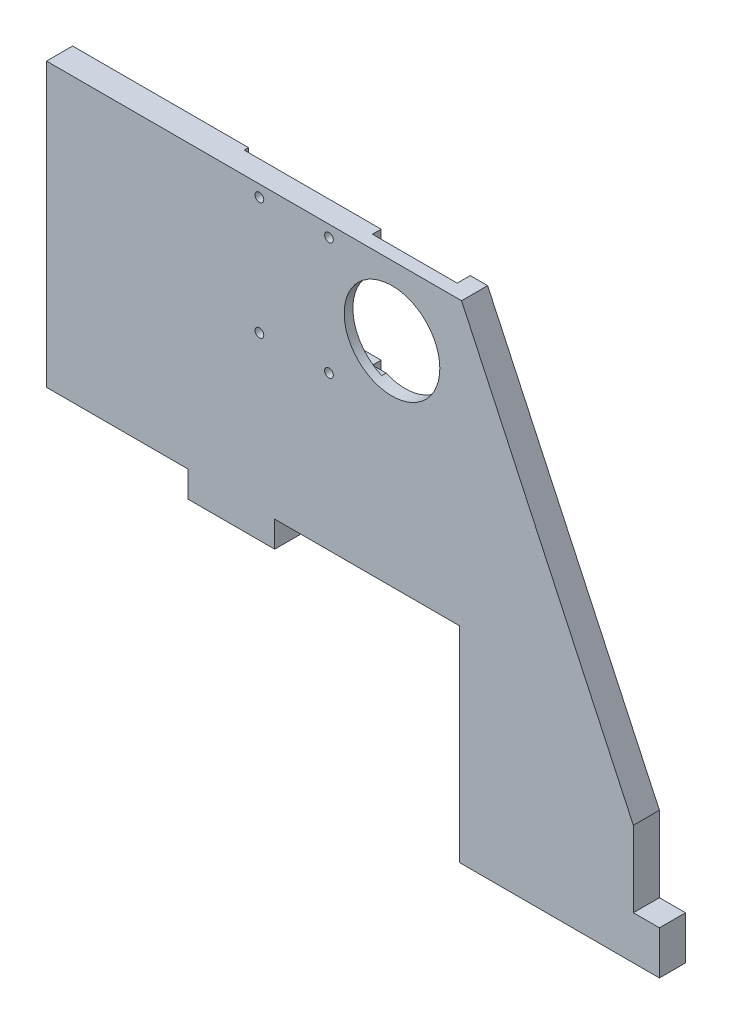
from build123d import *

# Parameters (mm, degrees)
ESQUISSE1_W             = 135
ESQUISSE1_H             = 112.17
BOSS_EXTRU_1_DEPTH      = 6
ENL_V_MAT_EXTRU_1_DEPTH = 6
ESQUISSE3_W             = 6
ESQUISSE3_H             = 10
ESQUISSE3_W_2           = 20
ESQUISSE3_H_2           = 6
BOSS_EXTRU_2_DEPTH      = 6
ESQUISSE4_W             = 51
ESQUISSE4_H             = 32
ENL_V_MAT_EXTRU_5_DEPTH = 3
ESQUISSE7_R             = 11
ENL_V_MAT_EXTRU_6_DEPTH = 93.502849821
ESQUISSE8_W             = 30
ESQUISSE8_H             = 20.2
ENL_V_MAT_EXTRU_7_DEPTH = 1
ESQUISSE9_W             = 25
ESQUISSE9_H             = 5.9
BOSS_EXTRU_4_DEPTH      = 2
ESQUISSE10_W            = 25
ESQUISSE10_H            = 5.9
BOSS_EXTRU_5_DEPTH      = 2
ESQUISSE11_W            = 6.5
ESQUISSE11_H            = 32
BOSS_EXTRU_6_DEPTH      = 2
ESQUISSE12_R            = 1
ENL_V_MAT_EXTRU_8_DEPTH = 93.589293253


with BuildPart() as part:
    # Esquisse1 → Boss.-Extru.1 (new body)
    with BuildSketch(Plane.XY):
        Rectangle(ESQUISSE1_W, ESQUISSE1_H)
    extrude(amount=BOSS_EXTRU_1_DEPTH)

    # Esquisse2 → Enlèv. mat.-Extru.1 (cut)
    with BuildSketch(Plane.XY.offset(6)):
        Polygon((27.5, -56.085), (-67.5, -56.085), (-67.5, -8.915), (-38.5, -8.915), (27.5, -8.915), align=None)
        Polygon((67.5, -28.665), (27.980425971, 56.085), (67.5, 56.085), align=None)
    extrude(amount=-ENL_V_MAT_EXTRU_1_DEPTH, mode=Mode.SUBTRACT)

    # Esquisse3 → Boss.-Extru.2 (add)
    with BuildSketch(Plane.XY.offset(6)):
        with Locations((70.5, -51.085)):
            Rectangle(ESQUISSE3_W, ESQUISSE3_H)
        with Locations((-25, -11.915)):
            Rectangle(ESQUISSE3_W_2, ESQUISSE3_H_2)
    extrude(amount=-BOSS_EXTRU_2_DEPTH)

    # Esquisse4 → Enlèv. mat.-Extru.5 (cut)
    with BuildSketch(Plane(origin=(0, 0, 0), x_dir=(-1, 0, 0), z_dir=(0, 0, -1))):
        with Locations((1.519574029, 40.085)):
            Rectangle(ESQUISSE4_W, ESQUISSE4_H)
    extrude(amount=-ENL_V_MAT_EXTRU_5_DEPTH, mode=Mode.SUBTRACT)

    # Esquisse7 → Enlèv. mat.-Extru.6 (cut, through all)
    with BuildSketch(Plane(origin=(0, 0, 3), x_dir=(-1, 0, 0), z_dir=(0, 0, -1))):
        with Locations((-11.980425971, 40.085)):
            Circle(ESQUISSE7_R)
    extrude(amount=-ENL_V_MAT_EXTRU_6_DEPTH, mode=Mode.SUBTRACT)

    # Esquisse8 → Enlèv. mat.-Extru.7 (cut)
    with BuildSketch(Plane(origin=(0, 0, 3), x_dir=(-1, 0, 0), z_dir=(0, 0, -1))):
        with Locations((5.519574029, 40.085)):
            Rectangle(ESQUISSE8_W, ESQUISSE8_H)
    extrude(amount=-ENL_V_MAT_EXTRU_7_DEPTH, mode=Mode.SUBTRACT)

    # Esquisse9 → Boss.-Extru.4 (add)
    with BuildSketch(Plane(origin=(0, 0, 3), x_dir=(-1, 0, 0), z_dir=(0, 0, -1))):
        with Locations((8.019574029, 53.135)):
            Rectangle(ESQUISSE9_W, ESQUISSE9_H)
    extrude(amount=BOSS_EXTRU_4_DEPTH)

    # Esquisse10 → Boss.-Extru.5 (add)
    with BuildSketch(Plane(origin=(0, 0, 3), x_dir=(-1, 0, 0), z_dir=(0, 0, -1))):
        with Locations((8.019574029, 27.035)):
            Rectangle(ESQUISSE10_W, ESQUISSE10_H)
    extrude(amount=BOSS_EXTRU_5_DEPTH)

    # Esquisse11 → Boss.-Extru.6 (add)
    with BuildSketch(Plane(origin=(0, 0, 3), x_dir=(-1, 0, 0), z_dir=(0, 0, -1))):
        with Locations((23.769574029, 40.085)):
            Rectangle(ESQUISSE11_W, ESQUISSE11_H)
    extrude(amount=BOSS_EXTRU_6_DEPTH)

    # Esquisse12 → Enlèv. mat.-Extru.8 (cut, through all)
    with BuildSketch(Plane(origin=(0, 0, 1), x_dir=(-1, 0, 0), z_dir=(0, 0, -1))):
        with Locations((2.519574029, 53.435)):
            Circle(ESQUISSE12_R)
        with Locations((18.519574029, 53.435)):
            Circle(ESQUISSE12_R)
        with Locations((2.519574029, 26.435)):
            Circle(ESQUISSE12_R)
        with Locations((18.519574029, 26.435)):
            Circle(ESQUISSE12_R)
    extrude(amount=-ENL_V_MAT_EXTRU_8_DEPTH, mode=Mode.SUBTRACT)


solid = part.part
